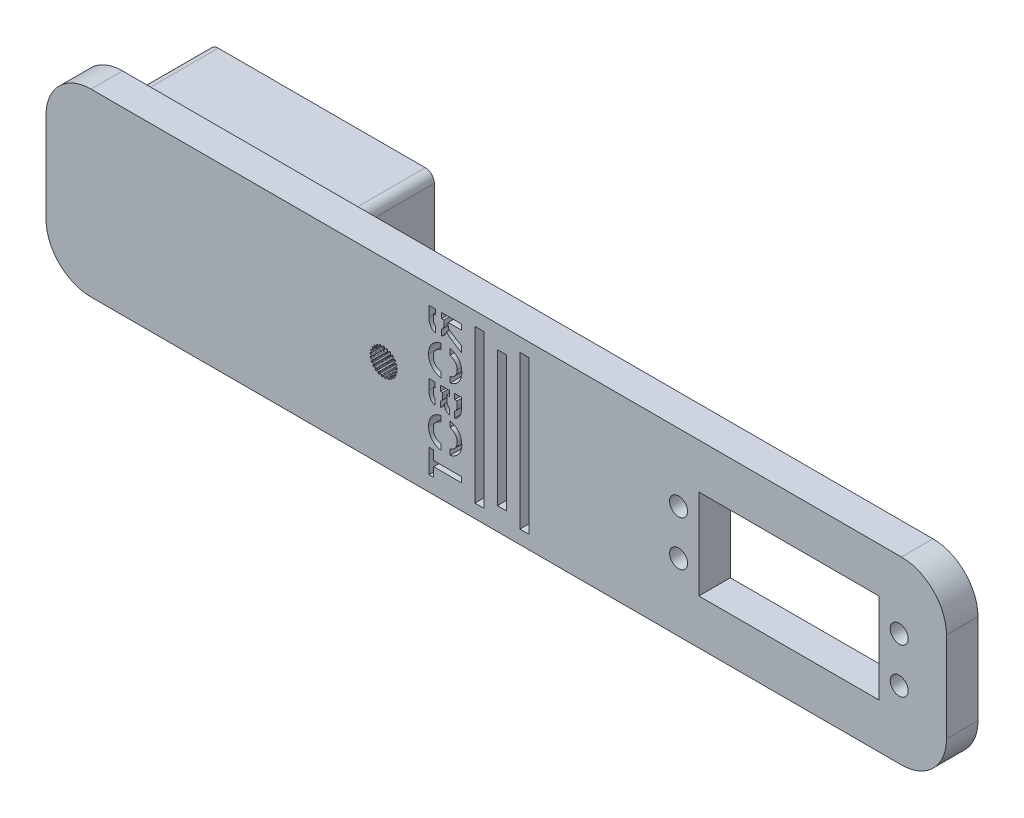
from build123d import *

# Parameters (mm, degrees)
CROQUIS1_W              = 200
CROQUIS1_H              = 40
SALIENTE_EXTRUIR1_DEPTH = 7
CROQUIS2_W              = 40
CROQUIS2_H              = 20
CORTAR_EXTRUIR1_DEPTH   = 10
CROQUIS3_R              = 2
CORTAR_EXTRUIR2_DEPTH   = 10
REDONDEO1_R             = 10
CROQUIS5_R              = 4
CORTAR_EXTRUIR3_DEPTH   = 4
CROQUIS6_W              = 50
CROQUIS6_H              = 30
SALIENTE_EXTRUIR3_DEPTH = 20
CROQUIS7_R              = 1.5
CORTAR_EXTRUIR6_DEPTH   = 10
REDONDEO3_R             = 2
CORTAR_EXTRUIR8_DEPTH   = 10
CROQUIS9_W              = 1.365556683
CROQUIS9_H              = 1.182778342
CROQUIS9_W_2            = 2
CROQUIS9_H_2            = 8
CROQUIS9_H_3            = 7
CROQUIS9_W_3            = 1.2
CROQUIS9_H_4            = 5.3
CROQUIS9_H_5            = 5
SALIENTE_EXTRUIR4_DEPTH = 7
CROQUIS10_W             = 2
CROQUIS10_H             = 34
CROQUIS10_H_2           = 30
CORTAR_EXTRUIR9_DEPTH   = 7
CROQUIS12_R             = 3.5
CROQUIS12_R_2           = 1.1
SALIENTE_EXTRUIR6_DEPTH = 3
CROQUIS13_R             = 2.75
CORTAR_EXTRUIR10_DEPTH  = 2.3


with BuildPart() as part:
    # Croquis1 → Saliente-Extruir1 (new body)
    with BuildSketch(Plane.XY):
        with Locations((35.75, 0)):
            Rectangle(CROQUIS1_W, CROQUIS1_H)
        with BuildLine():
            Line((12.626451574, 2.246768253), (12.528569084, 2.182348387))
            ThreePointArc((12.528569084, 2.182348387), (12.34583696, 2.19648114), (12.275928582, 2.365902456))
            Line((12.275928582, 2.365902456), (12.306948162, 2.47890107))
            add(Edge.make_bspline(
                [(12.306948162, 2.47890107), (12.313956369, 2.504430674), (12.318320471, 2.530953923), (12.317315161, 2.571661589), (12.315717027, 2.585623842), (12.30707454, 2.61274149), (12.299647057, 2.627040418), (12.286059536, 2.634961309)],
                knots=[0, 0, 0, 0, 0.5, 0.5, 0.75, 0.75, 1, 1, 1, 1], degree=3))
            ThreePointArc((12.286059536, 2.634961309), (12.219348706, 2.672735374), (12.151709558, 2.708820835))
            add(Edge.make_bspline(
                [(12.151709558, 2.708820835), (12.13775279, 2.71604292), (12.121806118, 2.714681589), (12.094149563, 2.707429812), (12.081587369, 2.701329447), (12.046673806, 2.680382622), (12.026552357, 2.662434562), (12.008750854, 2.642836427)],
                knots=[0, 0, 0, 0, 0.25, 0.25, 0.5, 0.5, 1, 1, 1, 1], degree=3))
            Line((12.008750854, 2.642836427), (11.929964091, 2.556098044))
            ThreePointArc((11.929964091, 2.556098044), (11.749458161, 2.524343159), (11.639612715, 2.671056287))
            Line((11.639612715, 2.671056287), (11.641556145, 2.788219097))
            add(Edge.make_bspline(
                [(11.641556145, 2.788219097), (11.641995222, 2.814689512), (11.639626154, 2.841464792), (11.628528843, 2.880643542), (11.623508646, 2.893769705), (11.608393794, 2.917886104), (11.59764366, 2.929888665), (11.58251317, 2.934181627)],
                knots=[0, 0, 0, 0, 0.5, 0.5, 0.75, 0.75, 1, 1, 1, 1], degree=3))
            ThreePointArc((11.58251317, 2.934181627), (11.508504156, 2.954178641), (11.434015927, 2.972309239))
            add(Edge.make_bspline(
                [(11.434015927, 2.972309239), (11.418701577, 2.975833522), (11.403594448, 2.970549183), (11.378610218, 2.956647329), (11.367959787, 2.947614528), (11.339352362, 2.918643136), (11.324326566, 2.896254945), (11.311958188, 2.872845469)],
                knots=[0, 0, 0, 0, 0.25, 0.25, 0.5, 0.5, 1, 1, 1, 1], degree=3))
            Line((11.311958188, 2.872845469), (11.257217615, 2.769238661))
            ThreePointArc((11.257217615, 2.769238661), (11.090279729, 2.693591414), (10.947399209, 2.808377827))
            Line((10.947399209, 2.808377827), (10.920144377, 2.922343064))
            add(Edge.make_bspline(
                [(10.920144377, 2.922343064), (10.913986734, 2.948091056), (10.905033354, 2.973435979), (10.884541326, 3.008624067), (10.876414505, 3.020089375), (10.855777008, 3.039689202), (10.842379694, 3.048641231), (10.826656941, 3.049036522)],
                knots=[0, 0, 0, 0, 0.5, 0.5, 0.75, 0.75, 1, 1, 1, 1], degree=3))
            ThreePointArc((10.826656941, 3.049036522), (10.75, 3.05), (10.673343059, 3.049036522))
            add(Edge.make_bspline(
                [(10.673343059, 3.049036522), (10.657633385, 3.048641559), (10.644315035, 3.039766248), (10.623572982, 3.020087821), (10.61550352, 3.008690147), (10.594999742, 2.973514567), (10.586013725, 2.948092979), (10.579855623, 2.922343064)],
                knots=[0, 0, 0, 0, 0.25, 0.25, 0.5, 0.5, 1, 1, 1, 1], degree=3))
            Line((10.579855623, 2.922343064), (10.552600791, 2.808377827))
            ThreePointArc((10.552600791, 2.808377827), (10.409720271, 2.693591414), (10.242782385, 2.769238661))
            Line((10.242782385, 2.769238661), (10.188041812, 2.872845469))
            add(Edge.make_bspline(
                [(10.188041812, 2.872845469), (10.175674357, 2.896253197), (10.160699238, 2.918575247), (10.132100083, 2.947561677), (10.121377275, 2.956645723), (10.096513865, 2.970497448), (10.081311173, 2.975836456), (10.065984073, 2.972309239)],
                knots=[0, 0, 0, 0, 0.5, 0.5, 0.75, 0.75, 1, 1, 1, 1], degree=3))
            ThreePointArc((10.065984073, 2.972309239), (9.991495844, 2.954178641), (9.91748683, 2.934181627))
            add(Edge.make_bspline(
                [(9.91748683, 2.934181627), (9.902368927, 2.929892236), (9.891676198, 2.917983619), (9.876479619, 2.893765087), (9.871498161, 2.880718699), (9.860386358, 2.841549142), (9.858004745, 2.814691489), (9.858443855, 2.788219097)],
                knots=[0, 0, 0, 0, 0.25, 0.25, 0.5, 0.5, 1, 1, 1, 1], degree=3))
            Line((9.858443855, 2.788219097), (9.860387285, 2.671056287))
            ThreePointArc((9.860387285, 2.671056287), (9.750541839, 2.524343159), (9.570035909, 2.556098044))
            Line((9.570035909, 2.556098044), (9.491249146, 2.642836427))
            add(Edge.make_bspline(
                [(9.491249146, 2.642836427), (9.473448973, 2.662433098), (9.453393056, 2.680329699), (9.418483765, 2.701293146), (9.405838722, 2.707425146), (9.378311658, 2.714658415), (9.362258829, 2.716048933), (9.348290442, 2.708820835)],
                knots=[0, 0, 0, 0, 0.5, 0.5, 0.75, 0.75, 1, 1, 1, 1], degree=3))
            ThreePointArc((9.348290442, 2.708820835), (9.280651294, 2.672735374), (9.213940464, 2.634961309))
            add(Edge.make_bspline(
                [(9.213940464, 2.634961309), (9.200364246, 2.627047007), (9.192969001, 2.612853348), (9.184272755, 2.585616451), (9.182692303, 2.571741101), (9.181670671, 2.531038735), (9.186043108, 2.504432581), (9.193051838, 2.47890107)],
                knots=[0, 0, 0, 0, 0.25, 0.25, 0.5, 0.5, 1, 1, 1, 1], degree=3))
            Line((9.193051838, 2.47890107), (9.224071418, 2.365902456))
            ThreePointArc((9.224071418, 2.365902456), (9.15416304, 2.19648114), (8.971430916, 2.182348387))
            Line((8.971430916, 2.182348387), (8.873548426, 2.246768253))
            add(Edge.make_bspline(
                [(8.873548426, 2.246768253), (8.851433984, 2.261322535), (8.827557457, 2.273669178), (8.788531508, 2.285292432), (8.774758767, 2.28808709), (8.746297675, 2.28824741), (8.730403367, 2.285602066), (8.718671378, 2.275127255)],
                knots=[0, 0, 0, 0, 0.5, 0.5, 0.75, 0.75, 1, 1, 1, 1], degree=3))
            ThreePointArc((8.718671378, 2.275127255), (8.662131327, 2.223354314), (8.606910368, 2.170176682))
            add(Edge.make_bspline(
                [(8.606910368, 2.170176682), (8.595728879, 2.159134754), (8.592095789, 2.143547892), (8.590446293, 2.115004024), (8.592366153, 2.101171551), (8.601498883, 2.061493855), (8.612350633, 2.036810963), (8.6254886, 2.013824572)],
                knots=[0, 0, 0, 0, 0.25, 0.25, 0.5, 0.5, 1, 1, 1, 1], degree=3))
            Line((8.6254886, 2.013824572), (8.683635255, 1.912090273))
            ThreePointArc((8.683635255, 1.912090273), (8.658056546, 1.730606132), (8.484579961, 1.671473755))
            Line((8.484579961, 1.671473755), (8.373752059, 1.709527367))
            add(Edge.make_bspline(
                [(8.373752059, 1.709527367), (8.34871288, 1.718124761), (8.322515994, 1.72414566), (8.28182553, 1.72569839), (8.267790482, 1.724980107), (8.240183677, 1.718057405), (8.22544659, 1.711542415), (8.216688161, 1.698479063)],
                knots=[0, 0, 0, 0, 0.5, 0.5, 0.75, 0.75, 1, 1, 1, 1], degree=3))
            ThreePointArc((8.216688161, 1.698479063), (8.174799827, 1.634271725), (8.134538476, 1.569031872))
            add(Edge.make_bspline(
                [(8.134538476, 1.569031872), (8.126454289, 1.555556123), (8.126811634, 1.539555439), (8.132312531, 1.511498115), (8.137612072, 1.498577664), (8.156325323, 1.462417734), (8.172974531, 1.441209022), (8.191416227, 1.422212069)],
                knots=[0, 0, 0, 0, 0.25, 0.25, 0.5, 0.5, 1, 1, 1, 1], degree=3))
            Line((8.191416227, 1.422212069), (8.273036389, 1.338134426))
            ThreePointArc((8.273036389, 1.338134426), (8.293394553, 1.155990777), (8.140073677, 1.055574279))
            Line((8.140073677, 1.055574279), (8.02326409, 1.064870589))
            add(Edge.make_bspline(
                [(8.02326409, 1.064870589), (7.996873478, 1.06697089), (7.970002278, 1.06628773), (7.930204032, 1.057672371), (7.91678855, 1.05348628), (7.89177067, 1.039915534), (7.879116787, 1.02994026), (7.873882245, 1.015109185)],
                knots=[0, 0, 0, 0, 0.5, 0.5, 0.75, 0.75, 1, 1, 1, 1], degree=3))
            ThreePointArc((7.873882245, 1.015109185), (7.849277625, 0.942501833), (7.82650565, 0.869299019))
            add(Edge.make_bspline(
                [(7.82650565, 0.869299019), (7.822026725, 0.85423618), (7.826352052, 0.838827055), (7.838657701, 0.813019221), (7.847003932, 0.801822632), (7.874121881, 0.771452529), (7.895522416, 0.755050617), (7.918109082, 0.741236752)],
                knots=[0, 0, 0, 0, 0.25, 0.25, 0.5, 0.5, 1, 1, 1, 1], degree=3))
            Line((7.918109082, 0.741236752), (8.018074257, 0.680098671))
            ThreePointArc((8.018074257, 0.680098671), (8.083090114, 0.508740269), (7.959558664, 0.37334919))
            Line((7.959558664, 0.37334919), (7.844106966, 0.353304075))
            add(Edge.make_bspline(
                [(7.844106966, 0.353304075), (7.81802314, 0.348775313), (7.792166043, 0.341431021), (7.755760685, 0.323188908), (7.743807714, 0.315798035), (7.722950724, 0.296431946), (7.713175135, 0.283623171), (7.711793384, 0.267956263)],
                knots=[0, 0, 0, 0, 0.5, 0.5, 0.75, 0.75, 1, 1, 1, 1], degree=3))
            ThreePointArc((7.711793384, 0.267956263), (7.706018478, 0.191511085), (7.702166726, 0.114944912))
            add(Edge.make_bspline(
                [(7.702166726, 0.114944912), (7.70157449, 0.099241437), (7.709596023, 0.085392082), (7.727933215, 0.06345534), (7.738801712, 0.054686135), (7.772620438, 0.032014124), (7.797427625, 0.021449605), (7.822740058, 0.013686803)],
                knots=[0, 0, 0, 0, 0.25, 0.25, 0.5, 0.5, 1, 1, 1, 1], degree=3))
            Line((7.822740058, 0.013686803), (7.934769066, -0.020670184))
            ThreePointArc((7.934769066, -0.020670184), (8.040357432, -0.170476261), (7.954377342, -0.332334803))
            Line((7.954377342, -0.332334803), (7.847537789, -0.380461833))
            add(Edge.make_bspline(
                [(7.847537789, -0.380461833), (7.823399691, -0.391335099), (7.800181394, -0.404879056), (7.769456406, -0.431601703), (7.759716995, -0.441732961), (7.744331416, -0.465677552), (7.738048359, -0.480515006), (7.740606219, -0.496033336)],
                knots=[0, 0, 0, 0, 0.5, 0.5, 0.75, 0.75, 1, 1, 1, 1], degree=3))
            ThreePointArc((7.740606219, -0.496033336), (7.754023885, -0.571513009), (7.769334376, -0.646631607))
            add(Edge.make_bspline(
                [(7.769334376, -0.646631607), (7.772666042, -0.661989012), (7.783879757, -0.673408389), (7.807096299, -0.690095674), (7.819804154, -0.695886493), (7.858198703, -0.709435846), (7.884853816, -0.713499165), (7.911301543, -0.714723137)],
                knots=[0, 0, 0, 0, 0.25, 0.25, 0.5, 0.5, 1, 1, 1, 1], degree=3))
            Line((7.911301543, -0.714723137), (8.028355188, -0.720140256))
            ThreePointArc((8.028355188, -0.720140256), (8.167881558, -0.83898114), (8.124855273, -1.017136977))
            Line((8.124855273, -1.017136977), (8.033340986, -1.090321925))
            add(Edge.make_bspline(
                [(8.033340986, -1.090321925), (8.012665303, -1.106856488), (7.993544696, -1.125749092), (7.970430643, -1.159273192), (7.963516754, -1.171508251), (7.954569319, -1.198526816), (7.95217358, -1.214460657), (7.958510333, -1.228855337)],
                knots=[0, 0, 0, 0, 0.5, 0.5, 0.75, 0.75, 1, 1, 1, 1], degree=3))
            ThreePointArc((7.958510333, -1.228855337), (7.99027749, -1.298626839), (8.023788209, -1.367577884))
            add(Edge.make_bspline(
                [(8.023788209, -1.367577884), (8.030834436, -1.381624256), (8.044535735, -1.389896134), (8.071172845, -1.400285439), (8.084921579, -1.402734013), (8.125479479, -1.406309352), (8.152307679, -1.403616158), (8.178228891, -1.398224395)],
                knots=[0, 0, 0, 0, 0.25, 0.25, 0.5, 0.5, 1, 1, 1, 1], degree=3))
            Line((8.178228891, -1.398224395), (8.292952264, -1.374361266))
            ThreePointArc((8.292952264, -1.374361266), (8.457649682, -1.454769748), (8.460280702, -1.638028695))
            Line((8.460280702, -1.638028695), (8.389841861, -1.73167308))
            add(Edge.make_bspline(
                [(8.389841861, -1.73167308), (8.373927722, -1.752830013), (8.360106223, -1.775884173), (8.346055445, -1.814103283), (8.342401504, -1.827673369), (8.340454413, -1.856068233), (8.342096526, -1.872097279), (8.351814009, -1.884463837)],
                knots=[0, 0, 0, 0, 0.5, 0.5, 0.75, 0.75, 1, 1, 1, 1], degree=3))
            ThreePointArc((8.351814009, -1.884463837), (8.39993461, -1.944143169), (8.449539955, -2.002594213))
            add(Edge.make_bspline(
                [(8.449539955, -2.002594213), (8.459858002, -2.014446966), (8.475185983, -2.019051594), (8.503569954, -2.02249012), (8.517495681, -2.021442596), (8.557668531, -2.01481927), (8.582984104, -2.005538785), (8.606750077, -1.993870071)],
                knots=[0, 0, 0, 0, 0.25, 0.25, 0.5, 0.5, 1, 1, 1, 1], degree=3))
            Line((8.606750077, -1.993870071), (8.711934685, -1.942226104))
            ThreePointArc((8.711934685, -1.942226104), (8.891454607, -1.979149823), (8.939577615, -2.155997045))
            Line((8.939577615, -2.155997045), (8.894640152, -2.264216847))
            add(Edge.make_bspline(
                [(8.894640152, -2.264216847), (8.8844875, -2.288666782), (8.876833565, -2.314433919), (8.872728924, -2.354946593), (8.872564522, -2.368999047), (8.877740118, -2.396986056), (8.883316902, -2.412103143), (8.895804531, -2.421664544)],
                knots=[0, 0, 0, 0, 0.5, 0.5, 0.75, 0.75, 1, 1, 1, 1], degree=3))
            ThreePointArc((8.895804531, -2.421664544), (8.957254981, -2.467501833), (9.019838066, -2.511780182))
            add(Edge.make_bspline(
                [(9.019838066, -2.511780182), (9.032779613, -2.520694566), (9.048771162, -2.521342617), (9.077118525, -2.517614308), (9.090346241, -2.513136507), (9.127609833, -2.496730684), (9.149822107, -2.481446035), (9.169939537, -2.464233558)],
                knots=[0, 0, 0, 0, 0.25, 0.25, 0.5, 0.5, 1, 1, 1, 1], degree=3))
            Line((9.169939537, -2.464233558), (9.258976245, -2.388053733))
            ThreePointArc((9.258976245, -2.388053733), (9.442038775, -2.379172636), (9.532630026, -2.538496172))
            Line((9.532630026, -2.538496172), (9.516017526, -2.654491542))
            add(Edge.make_bspline(
                [(9.516017526, -2.654491542), (9.512264289, -2.680698199), (9.511258844, -2.707559271), (9.51735825, -2.747819947), (9.520693716, -2.761471803), (9.532666797, -2.78729243), (9.541827843, -2.800547697), (9.556300973, -2.806703161)],
                knots=[0, 0, 0, 0, 0.5, 0.5, 0.75, 0.75, 1, 1, 1, 1], degree=3))
            ThreePointArc((9.556300973, -2.806703161), (9.627220114, -2.835818282), (9.698848615, -2.863141765))
            add(Edge.make_bspline(
                [(9.698848615, -2.863141765), (9.713600496, -2.868557655), (9.729250805, -2.86520841), (9.755780391, -2.854547531), (9.76747895, -2.846920809), (9.799491875, -2.821763326), (9.817205173, -2.801434904), (9.832410008, -2.779760188)],
                knots=[0, 0, 0, 0, 0.25, 0.25, 0.5, 0.5, 1, 1, 1, 1], degree=3))
            Line((9.832410008, -2.779760188), (9.899704311, -2.683831163))
            ThreePointArc((9.899704311, -2.683831163), (10.074806956, -2.629703282), (10.202174268, -2.761492248))
            Line((10.202174268, -2.761492248), (10.214930556, -2.877974772))
            add(Edge.make_bspline(
                [(10.214930556, -2.877974772), (10.217812565, -2.90429149), (10.223518785, -2.930558716), (10.239438989, -2.968037668), (10.246064745, -2.98043113), (10.264082998, -3.00246297), (10.276252684, -3.013023538), (10.291801916, -3.015386296)],
                knots=[0, 0, 0, 0, 0.5, 0.5, 0.75, 0.75, 1, 1, 1, 1], degree=3))
            ThreePointArc((10.291801916, -3.015386296), (10.367733638, -3.025949839), (10.443906871, -3.034601621))
            add(Edge.make_bspline(
                [(10.443906871, -3.034601621), (10.459542172, -3.036178717), (10.473867874, -3.029042621), (10.496912731, -3.012119033), (10.50634707, -3.001822605), (10.531097839, -2.9694942), (10.543199168, -2.945399316), (10.552536032, -2.920624261)],
                knots=[0, 0, 0, 0, 0.25, 0.25, 0.5, 0.5, 1, 1, 1, 1], degree=3))
            Line((10.552536032, -2.920624261), (10.593859583, -2.810973611))
            ThreePointArc((10.593859583, -2.810973611), (10.75, -2.715), (10.906140417, -2.810973611))
            Line((10.906140417, -2.810973611), (10.947463968, -2.920624261))
            add(Edge.make_bspline(
                [(10.947463968, -2.920624261), (10.956800135, -2.945397466), (10.968859477, -2.969420379), (10.993600155, -3.001762667), (11.003099879, -3.012119007), (11.026031152, -3.028977719), (11.040444811, -3.03618003), (11.056093129, -3.034601621)],
                knots=[0, 0, 0, 0, 0.5, 0.5, 0.75, 0.75, 1, 1, 1, 1], degree=3))
            ThreePointArc((11.056093129, -3.034601621), (11.132266362, -3.025949839), (11.208198084, -3.015386296))
            add(Edge.make_bspline(
                [(11.208198084, -3.015386296), (11.223734381, -3.013025504), (11.23583534, -3.002550944), (11.253947476, -2.980428019), (11.2605248, -2.968108848), (11.27645823, -2.930640833), (11.28218722, -2.904293456), (11.285069444, -2.877974772)],
                knots=[0, 0, 0, 0, 0.25, 0.25, 0.5, 0.5, 1, 1, 1, 1], degree=3))
            Line((11.285069444, -2.877974772), (11.297825732, -2.761492248))
            ThreePointArc((11.297825732, -2.761492248), (11.425193044, -2.629703282), (11.600295689, -2.683831163))
            Line((11.600295689, -2.683831163), (11.667589992, -2.779760188))
            add(Edge.make_bspline(
                [(11.667589992, -2.779760188), (11.682793692, -2.801433286), (11.700448423, -2.821702439), (11.732455027, -2.846875878), (11.744231816, -2.854544369), (11.770635253, -2.865170658), (11.786387222, -2.868562164), (11.801151385, -2.863141765)],
                knots=[0, 0, 0, 0, 0.5, 0.5, 0.75, 0.75, 1, 1, 1, 1], degree=3))
            ThreePointArc((11.801151385, -2.863141765), (11.872779886, -2.835818282), (11.943699027, -2.806703161))
            add(Edge.make_bspline(
                [(11.943699027, -2.806703161), (11.958160117, -2.800552817), (11.967275985, -2.787397949), (11.979317347, -2.761465751), (11.982624379, -2.747897895), (11.988739315, -2.707644524), (11.987735991, -2.680700157), (11.983982474, -2.654491542)],
                knots=[0, 0, 0, 0, 0.25, 0.25, 0.5, 0.5, 1, 1, 1, 1], degree=3))
            Line((11.983982474, -2.654491542), (11.967369974, -2.538496172))
            ThreePointArc((11.967369974, -2.538496172), (12.057961225, -2.379172636), (12.241023755, -2.388053733))
            Line((12.241023755, -2.388053733), (12.330060463, -2.464233558))
            add(Edge.make_bspline(
                [(12.330060463, -2.464233558), (12.35017639, -2.48144475), (12.372317199, -2.496686557), (12.409578637, -2.513109407), (12.422892513, -2.51760821), (12.451109087, -2.521334387), (12.467209612, -2.520701987), (12.480161934, -2.511780182)],
                knots=[0, 0, 0, 0, 0.5, 0.5, 0.75, 0.75, 1, 1, 1, 1], degree=3))
            ThreePointArc((12.480161934, -2.511780182), (12.542745019, -2.467501833), (12.604195469, -2.421664544))
            add(Edge.make_bspline(
                [(12.604195469, -2.421664544), (12.61667271, -2.412111097), (12.622230703, -2.39710249), (12.627444688, -2.368990435), (12.627273635, -2.355026412), (12.623185853, -2.314516952), (12.615513259, -2.288668608), (12.605359848, -2.264216847)],
                knots=[0, 0, 0, 0, 0.25, 0.25, 0.5, 0.5, 1, 1, 1, 1], degree=3))
            Line((12.605359848, -2.264216847), (12.560422385, -2.155997045))
            ThreePointArc((12.560422385, -2.155997045), (12.608545393, -1.979149823), (12.788065315, -1.942226104))
            Line((12.788065315, -1.942226104), (12.893249923, -1.993870071))
            add(Edge.make_bspline(
                [(12.893249923, -1.993870071), (12.917014121, -2.005537914), (12.942249819, -2.014794677), (12.982424817, -2.02143503), (12.99643922, -2.022481469), (13.024695981, -2.019073404), (13.040133407, -2.014456834), (13.050460045, -2.002594213)],
                knots=[0, 0, 0, 0, 0.5, 0.5, 0.75, 0.75, 1, 1, 1, 1], degree=3))
            ThreePointArc((13.050460045, -2.002594213), (13.10006539, -1.944143169), (13.148185991, -1.884463837))
            add(Edge.make_bspline(
                [(13.148185991, -1.884463837), (13.15789539, -1.872107566), (13.15954628, -1.856188265), (13.157605275, -1.827662736), (13.153966885, -1.814179958), (13.139933234, -1.775959767), (13.126073467, -1.752831593), (13.110158139, -1.73167308)],
                knots=[0, 0, 0, 0, 0.25, 0.25, 0.5, 0.5, 1, 1, 1, 1], degree=3))
            Line((13.110158139, -1.73167308), (13.039719298, -1.638028695))
            ThreePointArc((13.039719298, -1.638028695), (13.042350318, -1.454769748), (13.207047736, -1.374361266))
            Line((13.207047736, -1.374361266), (13.321771109, -1.398224395))
            add(Edge.make_bspline(
                [(13.321771109, -1.398224395), (13.347690385, -1.403615755), (13.374435321, -1.406305837), (13.414999536, -1.402746455), (13.428833889, -1.400274778), (13.455355361, -1.389946614), (13.469159698, -1.38163595), (13.476211791, -1.367577884)],
                knots=[0, 0, 0, 0, 0.5, 0.5, 0.75, 0.75, 1, 1, 1, 1], degree=3))
            ThreePointArc((13.476211791, -1.367577884), (13.50972251, -1.298626839), (13.541489667, -1.228855337))
            add(Edge.make_bspline(
                [(13.541489667, -1.228855337), (13.547821148, -1.214472631), (13.545461203, -1.198642904), (13.536487167, -1.171496266), (13.529610054, -1.159341906), (13.506512321, -1.125812499), (13.487336241, -1.106857723), (13.466659014, -1.090321925)],
                knots=[0, 0, 0, 0, 0.25, 0.25, 0.5, 0.5, 1, 1, 1, 1], degree=3))
            Line((13.466659014, -1.090321925), (13.375144727, -1.017136977))
            ThreePointArc((13.375144727, -1.017136977), (13.332118442, -0.83898114), (13.471644812, -0.720140256))
            Line((13.471644812, -0.720140256), (13.588698457, -0.714723137))
            add(Edge.make_bspline(
                [(13.588698457, -0.714723137), (13.615144209, -0.713499256), (13.641717899, -0.709453629), (13.680122533, -0.695918162), (13.692907573, -0.690083673), (13.716027314, -0.673484365), (13.727331184, -0.662001797), (13.730665624, -0.646631607)],
                knots=[0, 0, 0, 0, 0.5, 0.5, 0.75, 0.75, 1, 1, 1, 1], degree=3))
            ThreePointArc((13.730665624, -0.646631607), (13.745976115, -0.571513009), (13.759393781, -0.496033336))
            add(Edge.make_bspline(
                [(13.759393781, -0.496033336), (13.761949514, -0.480527915), (13.755727018, -0.465782402), (13.740283823, -0.441720378), (13.7306001, -0.431658137), (13.699889601, -0.404926291), (13.676602111, -0.391335911), (13.652462211, -0.380461833)],
                knots=[0, 0, 0, 0, 0.25, 0.25, 0.5, 0.5, 1, 1, 1, 1], degree=3))
            Line((13.652462211, -0.380461833), (13.545622658, -0.332334803))
            ThreePointArc((13.545622658, -0.332334803), (13.459642568, -0.170476261), (13.565230934, -0.020670184))
            Line((13.565230934, -0.020670184), (13.677259942, 0.013686803))
            add(Edge.make_bspline(
                [(13.677259942, 0.013686803), (13.702570484, 0.021449025), (13.727303207, 0.031976159), (13.761135154, 0.054637229), (13.772067551, 0.063467926), (13.790332863, 0.085295383), (13.798426003, 0.099228363), (13.797833274, 0.114944912)],
                knots=[0, 0, 0, 0, 0.5, 0.5, 0.75, 0.75, 1, 1, 1, 1], degree=3))
            ThreePointArc((13.797833274, 0.114944912), (13.793981522, 0.191511085), (13.788206616, 0.267956263))
            add(Edge.make_bspline(
                [(13.788206616, 0.267956263), (13.786826014, 0.283610138), (13.777131949, 0.296344921), (13.756189949, 0.315810427), (13.74430808, 0.3231483), (13.707914469, 0.341402925), (13.681978808, 0.348774975), (13.655893034, 0.353304075)],
                knots=[0, 0, 0, 0, 0.25, 0.25, 0.5, 0.5, 1, 1, 1, 1], degree=3))
            Line((13.655893034, 0.353304075), (13.540441336, 0.37334919))
            ThreePointArc((13.540441336, 0.37334919), (13.416909886, 0.508740269), (13.481925743, 0.680098671))
            Line((13.481925743, 0.680098671), (13.581890918, 0.741236752))
            add(Edge.make_bspline(
                [(13.581890918, 0.741236752), (13.604475898, 0.755049585), (13.625813604, 0.771396768), (13.65294708, 0.801759561), (13.66133991, 0.813031603), (13.673603116, 0.838715708), (13.677977004, 0.85422364), (13.67349435, 0.869299019)],
                knots=[0, 0, 0, 0, 0.5, 0.5, 0.75, 0.75, 1, 1, 1, 1], degree=3))
            ThreePointArc((13.67349435, 0.869299019), (13.650722375, 0.942501833), (13.626117755, 1.015109185))
            add(Edge.make_bspline(
                [(13.626117755, 1.015109185), (13.620887567, 1.029927923), (13.608331048, 1.039851804), (13.583206104, 1.053497701), (13.569872672, 1.05765014), (13.530082691, 1.06628054), (13.503128493, 1.066971047), (13.47673591, 1.064870589)],
                knots=[0, 0, 0, 0, 0.25, 0.25, 0.5, 0.5, 1, 1, 1, 1], degree=3))
            Line((13.47673591, 1.064870589), (13.359926323, 1.055574279))
            ThreePointArc((13.359926323, 1.055574279), (13.206605447, 1.155990777), (13.226963611, 1.338134426))
            Line((13.226963611, 1.338134426), (13.308583773, 1.422212069))
            add(Edge.make_bspline(
                [(13.308583773, 1.422212069), (13.327024092, 1.441207603), (13.343626056, 1.462347681), (13.362356165, 1.498504392), (13.367682076, 1.511509514), (13.373172633, 1.539436441), (13.373552441, 1.555544904), (13.365461524, 1.569031872)],
                knots=[0, 0, 0, 0, 0.5, 0.5, 0.75, 0.75, 1, 1, 1, 1], degree=3))
            ThreePointArc((13.365461524, 1.569031872), (13.325200173, 1.634271725), (13.283311839, 1.698479063))
            add(Edge.make_bspline(
                [(13.283311839, 1.698479063), (13.274560696, 1.711531548), (13.259930694, 1.718020973), (13.2322015, 1.72498984), (13.218254292, 1.725695933), (13.177568094, 1.724159827), (13.15128899, 1.718125403), (13.126247941, 1.709527367)],
                knots=[0, 0, 0, 0, 0.25, 0.25, 0.5, 0.5, 1, 1, 1, 1], degree=3))
            Line((13.126247941, 1.709527367), (13.015420039, 1.671473755))
            ThreePointArc((13.015420039, 1.671473755), (12.841943454, 1.730606132), (12.816364745, 1.912090273))
            Line((12.816364745, 1.912090273), (12.8745114, 2.013824572))
            add(Edge.make_bspline(
                [(12.8745114, 2.013824572), (12.887648385, 2.036809246), (12.898471445, 2.06141391), (12.907621304, 2.101092681), (12.909545649, 2.115013723), (12.907918567, 2.14342872), (12.90428043, 2.159125561), (12.893089632, 2.170176682)],
                knots=[0, 0, 0, 0, 0.5, 0.5, 0.75, 0.75, 1, 1, 1, 1], degree=3))
            ThreePointArc((12.893089632, 2.170176682), (12.837868673, 2.223354314), (12.781328622, 2.275127255))
            add(Edge.make_bspline(
                [(12.781328622, 2.275127255), (12.769606392, 2.285593352), (12.753822164, 2.288240566), (12.725231047, 2.288094523), (12.711546418, 2.285309903), (12.672520466, 2.273703811), (12.648567668, 2.261323622), (12.626451574, 2.246768253)],
                knots=[0, 0, 0, 0, 0.25, 0.25, 0.5, 0.5, 1, 1, 1, 1], degree=3))
        make_face(mode=Mode.SUBTRACT)
    extrude(amount=SALIENTE_EXTRUIR1_DEPTH)

    # Croquis2 → Cortar-Extruir1 (cut)
    with BuildSketch(Plane.XY.offset(7)):
        with Locations((100.75, 0)):
            Rectangle(CROQUIS2_W, CROQUIS2_H)
    extrude(amount=-CORTAR_EXTRUIR1_DEPTH, mode=Mode.SUBTRACT)

    # Croquis3 → Cortar-Extruir2 (cut)
    with BuildSketch(Plane.XY.offset(7)):
        with Locations((125.25, -5)):
            Circle(CROQUIS3_R)
        with Locations((125.25, 5)):
            Circle(CROQUIS3_R)
        with Locations((76.25, -5)):
            Circle(CROQUIS3_R)
        with Locations((76.25, 5)):
            Circle(CROQUIS3_R)
    extrude(amount=-CORTAR_EXTRUIR2_DEPTH, mode=Mode.SUBTRACT)

    # Redondeo1
    redondeo1_edges = [part.edges().sort_by_distance(p)[0] for p in [
        (-64.25, 20, 3.5),
        (135.75, 20, 3.5),
        (135.75, -20, 3.5),
        (-64.25, -20, 3.5),
    ]]
    fillet(redondeo1_edges, radius=REDONDEO1_R)

    # Croquis5 → Cortar-Extruir3 (cut)
    with BuildSketch(Plane(origin=(0, 0, 0), x_dir=(-1, 0, 0), z_dir=(0, 0, -1))):
        with Locations((-76.25, 5)):
            Circle(CROQUIS5_R)
        with Locations((-76.25, -5)):
            Circle(CROQUIS5_R)
        with Locations((-125.25, -5)):
            Circle(CROQUIS5_R)
        with Locations((-125.25, 5)):
            Circle(CROQUIS5_R)
    extrude(amount=-CORTAR_EXTRUIR3_DEPTH, mode=Mode.SUBTRACT)

    # Croquis6 → Saliente-Extruir3 (add)
    with BuildSketch(Plane(origin=(0, 0, 0), x_dir=(-1, 0, 0), z_dir=(0, 0, -1))):
        with Locations((30, 0)):
            Rectangle(CROQUIS6_W, CROQUIS6_H)
        Polygon((8, 9), (11, 9), (11, 12), (52, 12), (52, -9), (49, -9), (49, -12), (8, -12), align=None, mode=Mode.SUBTRACT)
    extrude(amount=SALIENTE_EXTRUIR3_DEPTH)

    # Croquis7 → Cortar-Extruir6 (cut)
    with BuildSketch(Plane(origin=(0, 0, -20), x_dir=(-1, 0, 0), z_dir=(0, 0, -1))):
        with Locations((8, 12)):
            Circle(CROQUIS7_R)
        with Locations((52, -12)):
            Circle(CROQUIS7_R)
    extrude(amount=-CORTAR_EXTRUIR6_DEPTH, mode=Mode.SUBTRACT)

    # Redondeo3
    redondeo3_edges = [part.edges().sort_by_distance(p)[0] for p in [
        (-11, 9, -10),
        (-49, -9, -10),
        (-5, 15, -10),
        (-55, 15, -10),
        (-55, -15, -10),
        (-5, -15, -10),
    ]]
    fillet(redondeo3_edges, radius=REDONDEO3_R)

    # Croquis8 → Cortar-Extruir8 (cut)
    # profile 1 of 5: a face of its own
    with BuildSketch(Plane(origin=(0, 0, 0), x_dir=(-1, 0, 0), z_dir=(0, 0, -1))):
        with BuildLine():
            Line((-28.00618762, 10.430626501), (-28.00618762, 11.817434107))
            Line((-28.00618762, 11.817434107), (-26.070866559, 12.960293679))
            add(Edge.make_bspline(
                [(-26.070866559, 12.960293679), (-25.987369997, 13.010443049), (-25.831169227, 13.104259728), (-25.620105585, 13.253749568), (-25.445481747, 13.402492715), (-25.303716928, 13.555324394), (-25.195141965, 13.71706574), (-25.122990345, 13.89524463), (-25.078909072, 14.090130751), (-25.074953918, 14.227094067), (-25.072897333, 14.298311679)],
                knots=[0, 0, 0, 0, 1.323310799, 2.475576959, 3.510754942, 4.43521603, 5.30084183, 6.141627031, 7.033691003, 8, 8, 8, 8], degree=3))
            Line((-25.072897333, 14.298311679), (-25.072897333, 14.777336907))
            Line((-25.072897333, 14.777336907), (-28.00618762, 14.777336907))
            Line((-28.00618762, 14.777336907), (-28.00618762, 15.960115249))
            Line((-28.00618762, 15.960115249), (-20.814895303, 15.960115249))
            Line((-20.814895303, 15.960115249), (-20.814895303, 13.604907876))
            add(Edge.make_bspline(
                [(-20.814895303, 13.604907876), (-20.816288085, 13.522559102), (-20.819020522, 13.361002834), (-20.841319481, 13.12327123), (-20.879766974, 12.895550323), (-20.932728275, 12.678004756), (-20.999984033, 12.472383659), (-21.083761883, 12.280201163), (-21.180563807, 12.100487955), (-21.294749805, 11.93595133), (-21.424113981, 11.787226594), (-21.568054917, 11.654056561), (-21.729414054, 11.540516873), (-21.903863603, 11.441633472), (-22.094883706, 11.365007553), (-22.2999693, 11.308168066), (-22.521030471, 11.276005756), (-22.673233737, 11.271330668), (-22.751694837, 11.268920651)],
                knots=[0, 0, 0, 0, 1.153521462, 2.263040625, 3.341337503, 4.38624968, 5.397122795, 6.368068286, 7.319674246, 8.252383051, 9.167524369, 10.076419807, 10.992185972, 11.925661073, 12.879543516, 13.867788059, 14.900840317, 16, 16, 16, 16], degree=3))
            add(Edge.make_bspline(
                [(-22.751694837, 11.268920651), (-22.813844246, 11.270429392), (-22.936027731, 11.273395523), (-23.115676436, 11.294149853), (-23.287265706, 11.329631645), (-23.451006901, 11.378653404), (-23.605946978, 11.440397692), (-23.752086206, 11.51524141), (-23.889802051, 11.600961452), (-24.019141592, 11.698286326), (-24.136731202, 11.809313483), (-24.24932595, 11.926845146), (-24.349086915, 12.058635507), (-24.442811465, 12.198559937), (-24.525782508, 12.349319592), (-24.595541803, 12.510598996), (-24.66100471, 12.67838397), (-24.692993729, 12.795841511), (-24.709192993, 12.855322102)],
                knots=[0, 0, 0, 0, 1.09156399, 2.145975237, 3.171383398, 4.165512793, 5.144450992, 6.096811633, 7.045585514, 7.990877933, 8.934226244, 9.883473879, 10.846164453, 11.832917356, 12.840188317, 13.86325536, 14.917950834, 16, 16, 16, 16], degree=3))
            Line((-24.709192993, 12.855322102), (-24.729891614, 12.855322102))
            add(Edge.make_bspline(
                [(-24.729891614, 12.855322102), (-24.767345594, 12.793681218), (-24.839771976, 12.674483576), (-24.970218385, 12.516639905), (-25.107671431, 12.376105587), (-25.246789368, 12.239366961), (-25.399408986, 12.10792663), (-25.571387525, 11.979231118), (-25.767610335, 11.844798435), (-25.906621636, 11.752671947), (-25.98067971, 11.703591691)],
                knots=[0, 0, 0, 0, 1.007333154, 1.947923689, 2.854426628, 3.755965988, 4.674540902, 5.668205659, 6.757739869, 8, 8, 8, 8], degree=3))
            Line((-25.98067971, 11.703591691), (-28.00618762, 10.430626501))
        make_face()
        with BuildLine():
            Line((-21.761117976, 14.777336907), (-24.126674659, 14.777336907))
            Line((-24.126674659, 14.777336907), (-24.126674659, 13.788238519))
            add(Edge.make_bspline(
                [(-24.126674659, 13.788238519), (-24.125483428, 13.743339776), (-24.123145368, 13.655215853), (-24.106336788, 13.525632084), (-24.07996117, 13.401424699), (-24.04326662, 13.282241849), (-23.994506192, 13.170538502), (-23.935945959, 13.065985667), (-23.869972189, 12.968352373), (-23.794091097, 12.878627285), (-23.707798118, 12.798803401), (-23.612621642, 12.727554987), (-23.508876083, 12.664995468), (-23.396085555, 12.613687587), (-23.275551559, 12.571498638), (-23.147513782, 12.542911073), (-23.012453696, 12.524235402), (-22.92030659, 12.522222265), (-22.872929617, 12.52118722)],
                knots=[0, 0, 0, 0, 1.074370724, 2.108695173, 3.12195728, 4.110548581, 5.08781706, 6.032954475, 6.975143395, 7.90394827, 8.838650852, 9.782241456, 10.745096954, 11.731998114, 12.742854643, 13.795775028, 14.866708795, 16, 16, 16, 16], degree=3))
            add(Edge.make_bspline(
                [(-22.872929617, 12.52118722), (-22.830475537, 12.521689642), (-22.747693137, 12.522669329), (-22.627201449, 12.54047498), (-22.51346314, 12.564285278), (-22.406960749, 12.600467552), (-22.308107723, 12.646462018), (-22.214813041, 12.70097142), (-22.13097946, 12.768373954), (-22.053201999, 12.844201154), (-21.983653672, 12.929673386), (-21.924441864, 13.025437664), (-21.874018082, 13.129512072), (-21.832671611, 13.242486624), (-21.800377841, 13.364255602), (-21.776544536, 13.494701947), (-21.763589893, 13.634211476), (-21.761957658, 13.730059795), (-21.761117976, 13.779367681)],
                knots=[0, 0, 0, 0, 1.066624438, 2.079840893, 3.057245445, 3.986214421, 4.901269529, 5.796207348, 6.696366002, 7.599166298, 8.524489645, 9.459968529, 10.4245567, 11.428480888, 12.480821637, 13.589470439, 14.759935305, 16, 16, 16, 16], degree=3))
            Line((-21.761117976, 13.779367681), (-21.761117976, 14.777336907))
        make_face(mode=Mode.SUBTRACT)
    # profile 2 of 5: a face of its own
    with BuildSketch(Plane(origin=(0, 0, 0), x_dir=(-1, 0, 0), z_dir=(0, 0, -1))):
        with BuildLine():
            add(Edge.make_bspline(
                [(-28.100809888, 6.670869847), (-28.097555158, 6.796673766), (-28.091189279, 7.042731812), (-28.04525804, 7.402388097), (-27.966936452, 7.742666023), (-27.857159204, 8.063813911), (-27.7169701, 8.366218468), (-27.54142122, 8.646806218), (-27.338478129, 8.910873037), (-27.103048223, 9.151887562), (-26.844116917, 9.369875071), (-26.564561696, 9.560805502), (-26.265233785, 9.720582333), (-25.947896215, 9.85362649), (-25.61015279, 9.952370244), (-25.255567244, 10.02766492), (-24.881237786, 10.07015263), (-24.625515691, 10.075842046), (-24.494814418, 10.078749944)],
                knots=[0, 0, 0, 0, 1.080772804, 2.11386774, 3.109173853, 4.075987392, 5.025038086, 5.966272846, 6.914037973, 7.881268696, 8.854993546, 9.81805361, 10.784245676, 11.765646471, 12.769053207, 13.802980878, 14.877088833, 16, 16, 16, 16], degree=3))
            add(Edge.make_bspline(
                [(-24.494814418, 10.078749944), (-24.354726264, 10.076071654), (-24.081209048, 10.070842387), (-23.681709358, 10.025381779), (-23.30401923, 9.952710277), (-22.948148124, 9.848627835), (-22.613319293, 9.715691277), (-22.300883025, 9.551204584), (-22.010030576, 9.357473434), (-21.742951871, 9.13599504), (-21.50132796, 8.889724313), (-21.291773804, 8.619091241), (-21.114752049, 8.32674025), (-20.968694838, 8.01379994), (-20.859086188, 7.678194665), (-20.776543732, 7.323277894), (-20.729652976, 6.94613565), (-20.723447888, 6.687751829), (-20.720273035, 6.555548959)],
                knots=[0, 0, 0, 0, 1.15222704, 2.249682958, 3.303300419, 4.313064797, 5.295631801, 6.262317599, 7.212562825, 8.165710149, 9.111907019, 10.045395757, 10.97510803, 11.91840756, 12.880046247, 13.874430042, 14.912445645, 16, 16, 16, 16], degree=3))
            add(Edge.make_bspline(
                [(-20.720273035, 6.555548959), (-20.723528173, 6.432701597), (-20.729891972, 6.192534816), (-20.77582861, 5.841178201), (-20.854606742, 5.509124281), (-20.96215341, 5.194174891), (-21.103914666, 4.898542749), (-21.275876396, 4.620500874), (-21.480408035, 4.361785328), (-21.713476316, 4.12317409), (-21.971108675, 3.908173626), (-22.249916859, 3.720255098), (-22.548058312, 3.561270481), (-22.866435211, 3.433698209), (-23.202131759, 3.329552378), (-23.558168827, 3.260859671), (-23.932854649, 3.216434809), (-24.189129817, 3.211045717), (-24.320354613, 3.208286252)],
                knots=[0, 0, 0, 0, 1.065692615, 2.083430705, 3.067636031, 4.022280856, 4.965132829, 5.906034102, 6.852939541, 7.820500082, 8.79496093, 9.759085981, 10.732692833, 11.720421136, 12.730767492, 13.777262481, 14.861855098, 16, 16, 16, 16], degree=3))
            add(Edge.make_bspline(
                [(-24.320354613, 3.208286252), (-24.462406135, 3.210977693), (-24.739349685, 3.216224924), (-25.143378829, 3.261309422), (-25.5245201, 3.335171106), (-25.884260026, 3.435786198), (-26.21950403, 3.569995046), (-26.533140798, 3.731204314), (-26.822091113, 3.925040856), (-27.088580224, 4.144515872), (-27.326681696, 4.390320626), (-27.534824594, 4.657258486), (-27.710455317, 4.944422483), (-27.853155762, 5.251632335), (-27.963911473, 5.578427587), (-28.043866825, 5.925008973), (-28.091553261, 6.291543642), (-28.097679564, 6.542592699), (-28.100809888, 6.670869847)],
                knots=[0, 0, 0, 0, 1.177162618, 2.29499542, 3.364500604, 4.39244573, 5.386145376, 6.352647156, 7.309989713, 8.264504434, 9.209143387, 10.140645842, 11.064711375, 11.993091647, 12.942558309, 13.919569025, 14.93697369, 16, 16, 16, 16], degree=3))
        make_face()
        with BuildLine():
            add(Edge.make_bspline(
                [(-21.761117976, 6.616166349), (-21.763452835, 6.696119707), (-21.768043375, 6.853315138), (-21.802359015, 7.083495718), (-21.860227582, 7.302060803), (-21.940458323, 7.508908842), (-22.042920629, 7.704356021), (-22.170204638, 7.887422673), (-22.320107732, 8.059287608), (-22.491760196, 8.217854195), (-22.679944392, 8.36365859), (-22.887111577, 8.48693218), (-23.106397632, 8.594030886), (-23.340229999, 8.682356051), (-23.589808215, 8.747421286), (-23.852997318, 8.796867267), (-24.131017161, 8.824474929), (-24.320789983, 8.828737039), (-24.417933826, 8.830918794)],
                knots=[0, 0, 0, 0, 0.988277837, 1.943042342, 2.86970776, 3.778308816, 4.680451489, 5.591439712, 6.528602368, 7.494308428, 8.476557367, 9.466130372, 10.46895181, 11.49087912, 12.550597948, 13.653642968, 14.798910525, 16, 16, 16, 16], degree=3))
            add(Edge.make_bspline(
                [(-24.417933826, 8.830918794), (-24.51459752, 8.829407879), (-24.703427269, 8.82645635), (-24.979744013, 8.797791255), (-25.24164622, 8.750654685), (-25.489754372, 8.686107908), (-25.723092423, 8.601868686), (-25.941371942, 8.497391389), (-26.146653006, 8.37642571), (-26.335099646, 8.23625874), (-26.505154432, 8.081373005), (-26.654390498, 7.914037438), (-26.778938275, 7.733759546), (-26.882464709, 7.542742339), (-26.962428255, 7.339691241), (-27.018116715, 7.125176087), (-27.053351252, 6.899714375), (-27.057725631, 6.745420164), (-27.059964947, 6.666434429)],
                knots=[0, 0, 0, 0, 1.209576796, 2.362873517, 3.472383614, 4.537664675, 5.56795712, 6.572273746, 7.56245417, 8.545712799, 9.506284641, 10.437062317, 11.345664602, 12.242634409, 13.150985398, 14.06964528, 15.011819787, 16, 16, 16, 16], degree=3))
            add(Edge.make_bspline(
                [(-27.059964947, 6.666434429), (-27.058152308, 6.583041565), (-27.054598282, 6.419533846), (-27.021646235, 6.181164859), (-26.966996645, 5.956776008), (-26.891242562, 5.745783813), (-26.793041924, 5.548653148), (-26.674665639, 5.363759389), (-26.532439256, 5.194134155), (-26.369688899, 5.039071643), (-26.187851366, 4.900085495), (-25.987823136, 4.779642728), (-25.770715451, 4.677578572), (-25.536199156, 4.593110045), (-25.284155735, 4.528459434), (-25.015055344, 4.483524174), (-24.729541423, 4.454540398), (-24.533328259, 4.451673522), (-24.432718555, 4.450203511)],
                knots=[0, 0, 0, 0, 1.028373538, 2.01632373, 2.961538043, 3.873148788, 4.775856215, 5.673039178, 6.575255091, 7.499810268, 8.441007585, 9.39298277, 10.374777683, 11.395991303, 12.463621828, 13.58009586, 14.759176832, 16, 16, 16, 16], degree=3))
            add(Edge.make_bspline(
                [(-24.432718555, 4.450203511), (-24.329172316, 4.451856341), (-24.127634158, 4.455073341), (-23.834523503, 4.481386364), (-23.559337939, 4.527375733), (-23.302666022, 4.590281855), (-23.063310359, 4.670266676), (-22.842189994, 4.768622024), (-22.640508807, 4.888220484), (-22.455990751, 5.02204852), (-22.293270216, 5.173853335), (-22.149572522, 5.338419711), (-22.029330021, 5.518527298), (-21.931459829, 5.712412353), (-21.85391083, 5.919001475), (-21.799683856, 6.139287208), (-21.766285696, 6.373160693), (-21.762870653, 6.533748861), (-21.761117976, 6.616166349)],
                knots=[0, 0, 0, 0, 1.275971675, 2.483499004, 3.622776443, 4.711370894, 5.736996491, 6.729241299, 7.687558615, 8.621725317, 9.532842858, 10.424170042, 11.308537927, 12.194031307, 13.095400077, 14.021954072, 14.984821984, 16, 16, 16, 16], degree=3))
        make_face(mode=Mode.SUBTRACT)
    # profile 3 of 5: a face of its own
    with BuildSketch(Plane(origin=(0, 0, 0), x_dir=(-1, 0, 0), z_dir=(0, 0, -1))):
        with BuildLine():
            Line((-28.00618762, 1.861397415), (-20.814895303, 1.861397415))
            Line((-20.814895303, 1.861397415), (-20.814895303, -0.409537001))
            add(Edge.make_bspline(
                [(-20.814895303, -0.409537001), (-20.816436916, -0.493841982), (-20.819443822, -0.658278278), (-20.839228354, -0.89809249), (-20.877052438, -1.124127902), (-20.92662169, -1.33675579), (-20.989929692, -1.537133532), (-21.069943303, -1.722886908), (-21.163141028, -1.896199955), (-21.271212219, -2.053376665), (-21.388564596, -2.196478808), (-21.518400512, -2.318888778), (-21.654123616, -2.425882419), (-21.801147454, -2.510158721), (-21.95555887, -2.577889399), (-22.119312924, -2.624138817), (-22.291154516, -2.65590453), (-22.40903077, -2.658464011), (-22.469306508, -2.659772796)],
                knots=[0, 0, 0, 0, 1.29321255, 2.522402362, 3.686871397, 4.805358411, 5.86919678, 6.905471082, 7.903342584, 8.882513086, 9.827167866, 10.736122769, 11.614610136, 12.471629195, 13.32824809, 14.19425496, 15.076636638, 16, 16, 16, 16], degree=3))
            add(Edge.make_bspline(
                [(-22.469306508, -2.659772796), (-22.51961863, -2.658558776), (-22.619025878, -2.656160101), (-22.765808299, -2.639435976), (-22.907666597, -2.613010772), (-23.044554146, -2.576545983), (-23.175556151, -2.526513717), (-23.302423085, -2.467940258), (-23.424635156, -2.398402695), (-23.539299822, -2.316302938), (-23.64908568, -2.22702437), (-23.749378354, -2.127007669), (-23.843354252, -2.020269741), (-23.928785397, -1.905002429), (-24.006476113, -1.781701004), (-24.073619024, -1.649478582), (-24.135571115, -1.510344879), (-24.167904909, -1.412746155), (-24.184335104, -1.363152039)],
                knots=[0, 0, 0, 0, 1.044047944, 2.062841511, 3.061830658, 4.036920506, 4.998180123, 5.968268512, 6.934954113, 7.911116195, 8.891982185, 9.868358572, 10.846875434, 11.841035983, 12.842796257, 13.86747693, 14.916373149, 16, 16, 16, 16], degree=3))
            Line((-24.184335104, -1.363152039), (-24.203555252, -1.363152039))
            add(Edge.make_bspline(
                [(-24.203555252, -1.363152039), (-24.211291605, -1.423477791), (-24.226438495, -1.541588669), (-24.267964421, -1.71214596), (-24.317579788, -1.874109916), (-24.379570678, -2.027444173), (-24.455318485, -2.170442242), (-24.541439157, -2.30484806), (-24.639602599, -2.429467666), (-24.748576553, -2.544740674), (-24.868416498, -2.648298773), (-24.997053207, -2.738710535), (-25.1347913, -2.815165663), (-25.281291464, -2.876546647), (-25.436361871, -2.926527703), (-25.600605025, -2.959254487), (-25.773125649, -2.980784771), (-25.890917607, -2.983598832), (-25.951110251, -2.98503684)],
                knots=[0, 0, 0, 0, 1.105197932, 2.163850295, 3.187126427, 4.184003295, 5.166148081, 6.125708003, 7.083089199, 8.046658442, 9.006092802, 9.958342805, 10.901056294, 11.864833898, 12.842675954, 13.85858675, 14.905720485, 16, 16, 16, 16], degree=3))
            add(Edge.make_bspline(
                [(-25.951110251, -2.98503684), (-26.026156472, -2.982774947), (-26.173100764, -2.978346048), (-26.387815962, -2.943251565), (-26.59133832, -2.887427995), (-26.78429321, -2.808530441), (-26.965452197, -2.705332255), (-27.136379278, -2.580664696), (-27.295740396, -2.432486396), (-27.442458033, -2.263130323), (-27.574051291, -2.076289945), (-27.690836953, -1.876903391), (-27.787767447, -1.665090971), (-27.868456686, -1.441703867), (-27.929935972, -1.206542082), (-27.974303454, -0.959416036), (-28.001272545, -0.70090468), (-28.004530529, -0.524430268), (-28.00618762, -0.434671041)],
                knots=[0, 0, 0, 0, 0.982317545, 1.923427403, 2.8409632, 3.741014849, 4.645567072, 5.564644947, 6.505422824, 7.48894802, 8.493506847, 9.494139937, 10.510569398, 11.539441117, 12.600772783, 13.68943852, 14.824791592, 16, 16, 16, 16], degree=3))
            Line((-28.00618762, -0.434671041), (-28.00618762, 1.861397415))
        make_face()
        with BuildLine():
            Line((-21.761117976, 0.678619074), (-23.842807857, 0.678619074))
            Line((-23.842807857, 0.678619074), (-23.842807857, -0.090186849))
            add(Edge.make_bspline(
                [(-23.842807857, -0.090186849), (-23.842220241, -0.140511361), (-23.841076823, -0.238435811), (-23.824582779, -0.380905039), (-23.804666681, -0.516055414), (-23.769118419, -0.641496176), (-23.728544332, -0.759902809), (-23.676504659, -0.869183282), (-23.615839017, -0.970396098), (-23.545936377, -1.062605236), (-23.468001441, -1.145323279), (-23.381575345, -1.217634595), (-23.285529084, -1.276135932), (-23.183724897, -1.327296501), (-23.073370152, -1.365726451), (-22.955722113, -1.391795135), (-22.830530088, -1.408539109), (-22.74435822, -1.410784467), (-22.699948285, -1.411941645)],
                knots=[0, 0, 0, 0, 1.217730545, 2.369533015, 3.470124009, 4.520938767, 5.521137799, 6.497999481, 7.445557499, 8.373986296, 9.294095119, 10.192512585, 11.093146414, 12.011085897, 12.947076371, 13.913974302, 14.924936085, 16, 16, 16, 16], degree=3))
            add(Edge.make_bspline(
                [(-22.699948285, -1.411941645), (-22.661939777, -1.411296972), (-22.588076897, -1.410044163), (-22.4812471, -1.394423137), (-22.381254828, -1.371627111), (-22.289260872, -1.337002469), (-22.203771975, -1.29437154), (-22.126756393, -1.240412685), (-22.056187577, -1.177904699), (-21.994122115, -1.104856347), (-21.939543355, -1.022530104), (-21.889780809, -0.932220067), (-21.850352594, -0.830553317), (-21.81867811, -0.719467061), (-21.791114132, -0.599752384), (-21.77487104, -0.469988261), (-21.761752595, -0.33095146), (-21.761334284, -0.23462118), (-21.761117976, -0.184809116)],
                knots=[0, 0, 0, 0, 1.033773763, 2.008958317, 2.933067993, 3.820214093, 4.678174138, 5.526642016, 6.372241466, 7.238032157, 8.12730583, 9.057723496, 10.039254519, 11.087807723, 12.200967183, 13.379161911, 14.644773411, 16, 16, 16, 16], degree=3))
            Line((-21.761117976, -0.184809116), (-21.761117976, 0.678619074))
        make_face(mode=Mode.SUBTRACT)
        with BuildLine():
            Line((-24.789030531, 0.678619074), (-27.059964947, 0.678619074))
            Line((-27.059964947, 0.678619074), (-27.059964947, -0.334134882))
            add(Edge.make_bspline(
                [(-27.059964947, -0.334134882), (-27.059307209, -0.387894864), (-27.058025253, -0.492675103), (-27.042519677, -0.644738492), (-27.019745153, -0.787827393), (-26.985145124, -0.92109262), (-26.94329936, -1.045952117), (-26.889062693, -1.160286195), (-26.827667326, -1.266315652), (-26.754486407, -1.360599531), (-26.67443216, -1.446090158), (-26.585752199, -1.519625318), (-26.489697383, -1.582905334), (-26.386400035, -1.634317004), (-26.275866905, -1.674723681), (-26.158278607, -1.702653826), (-26.033371922, -1.718843863), (-25.947708431, -1.721208762), (-25.903799118, -1.72242096)],
                knots=[0, 0, 0, 0, 1.259711535, 2.455225457, 3.579574161, 4.65272412, 5.679347729, 6.661319729, 7.614322676, 8.54550905, 9.452591405, 10.354879228, 11.239239016, 12.143373899, 13.053394181, 13.992074989, 14.97077964, 16, 16, 16, 16], degree=3))
            add(Edge.make_bspline(
                [(-25.903799118, -1.72242096), (-25.858908768, -1.721273023), (-25.771224888, -1.719030768), (-25.643979739, -1.702004314), (-25.526053742, -1.66967391), (-25.415510201, -1.62931418), (-25.314602574, -1.574245212), (-25.223194056, -1.506426589), (-25.140041927, -1.427325728), (-25.064043536, -1.337260332), (-24.999127255, -1.233798888), (-24.942331196, -1.118966948), (-24.896155158, -0.991142266), (-24.855338478, -0.852208037), (-24.827188983, -0.700478103), (-24.804641024, -0.537737279), (-24.791416263, -0.362935178), (-24.789842291, -0.242491373), (-24.789030531, -0.180373697)],
                knots=[0, 0, 0, 0, 0.994668398, 1.942876034, 2.835505072, 3.699487564, 4.544844098, 5.37259676, 6.214561113, 7.08281157, 7.97644195, 8.914090081, 9.916104153, 10.984077127, 12.119114242, 13.331417407, 14.623705467, 16, 16, 16, 16], degree=3))
            Line((-24.789030531, -0.180373697), (-24.789030531, 0.678619074))
        make_face(mode=Mode.SUBTRACT)
    # profile 4 of 5: a face of its own
    with BuildSketch(Plane(origin=(0, 0, 0), x_dir=(-1, 0, 0), z_dir=(0, 0, -1))):
        with BuildLine():
            add(Edge.make_bspline(
                [(-28.100809888, -7.238603451), (-28.097555158, -7.112799533), (-28.091189279, -6.866741487), (-28.04525804, -6.507085202), (-27.966936452, -6.166807275), (-27.857159204, -5.845659387), (-27.7169701, -5.543254831), (-27.54142122, -5.262667081), (-27.338478129, -4.998600262), (-27.103048223, -4.757585737), (-26.844116917, -4.539598228), (-26.564561696, -4.348667797), (-26.265233785, -4.188890966), (-25.947896215, -4.055846809), (-25.61015279, -3.957103055), (-25.255567244, -3.881808379), (-24.881237786, -3.839320668), (-24.625515691, -3.833631253), (-24.494814418, -3.830723354)],
                knots=[0, 0, 0, 0, 1.080772804, 2.11386774, 3.109173853, 4.075987392, 5.025038086, 5.966272846, 6.914037973, 7.881268696, 8.854993546, 9.81805361, 10.784245676, 11.765646471, 12.769053207, 13.802980878, 14.877088833, 16, 16, 16, 16], degree=3))
            add(Edge.make_bspline(
                [(-24.494814418, -3.830723354), (-24.354726264, -3.833401644), (-24.081209048, -3.838630912), (-23.681709358, -3.88409152), (-23.30401923, -3.956763021), (-22.948148124, -4.060845463), (-22.613319293, -4.193782022), (-22.300883025, -4.358268715), (-22.010030576, -4.551999864), (-21.742951871, -4.773478259), (-21.50132796, -5.019748986), (-21.291773804, -5.290382057), (-21.114752049, -5.582733049), (-20.968694838, -5.895673358), (-20.859086188, -6.231278634), (-20.776543732, -6.586195404), (-20.729652976, -6.963337648), (-20.723447888, -7.221721469), (-20.720273035, -7.35392434)],
                knots=[0, 0, 0, 0, 1.15222704, 2.249682958, 3.303300419, 4.313064797, 5.295631801, 6.262317599, 7.212562825, 8.165710149, 9.111907019, 10.045395757, 10.97510803, 11.91840756, 12.880046247, 13.874430042, 14.912445645, 16, 16, 16, 16], degree=3))
            add(Edge.make_bspline(
                [(-20.720273035, -7.35392434), (-20.723528173, -7.476771701), (-20.729891972, -7.716938483), (-20.77582861, -8.068295098), (-20.854606742, -8.400349018), (-20.96215341, -8.715298407), (-21.103914666, -9.01093055), (-21.275876396, -9.288972425), (-21.480408035, -9.547687971), (-21.713476316, -9.786299208), (-21.971108675, -10.001299672), (-22.249916859, -10.189218201), (-22.548058312, -10.348202818), (-22.866435211, -10.47577509), (-23.202131759, -10.579920921), (-23.558168827, -10.648613628), (-23.932854649, -10.69303849), (-24.189129817, -10.698427581), (-24.320354613, -10.701187047)],
                knots=[0, 0, 0, 0, 1.065692615, 2.083430705, 3.067636031, 4.022280856, 4.965132829, 5.906034102, 6.852939541, 7.820500082, 8.79496093, 9.759085981, 10.732692833, 11.720421136, 12.730767492, 13.777262481, 14.861855098, 16, 16, 16, 16], degree=3))
            add(Edge.make_bspline(
                [(-24.320354613, -10.701187047), (-24.462406135, -10.698495606), (-24.739349685, -10.693248375), (-25.143378829, -10.648163877), (-25.5245201, -10.574302193), (-25.884260026, -10.473687101), (-26.21950403, -10.339478253), (-26.533140798, -10.178268984), (-26.822091113, -9.984432443), (-27.088580224, -9.764957426), (-27.326681696, -9.519152673), (-27.534824594, -9.252214813), (-27.710455317, -8.965050816), (-27.853155762, -8.657840964), (-27.963911473, -8.331045712), (-28.043866825, -7.984464326), (-28.091553261, -7.617929657), (-28.097679564, -7.3668806), (-28.100809888, -7.238603451)],
                knots=[0, 0, 0, 0, 1.177162618, 2.29499542, 3.364500604, 4.39244573, 5.386145376, 6.352647156, 7.309989713, 8.264504434, 9.209143387, 10.140645842, 11.064711375, 11.993091647, 12.942558309, 13.919569025, 14.93697369, 16, 16, 16, 16], degree=3))
        make_face()
        with BuildLine():
            add(Edge.make_bspline(
                [(-21.761117976, -7.29330695), (-21.763452835, -7.213353592), (-21.768043375, -7.056158161), (-21.802359015, -6.82597758), (-21.860227582, -6.607412496), (-21.940458323, -6.400564457), (-22.042920629, -6.205117278), (-22.170204638, -6.022050626), (-22.320107732, -5.850185691), (-22.491760196, -5.691619104), (-22.679944392, -5.545814709), (-22.887111577, -5.422541119), (-23.106397632, -5.315442412), (-23.340229999, -5.227117248), (-23.589808215, -5.162052013), (-23.852997318, -5.112606032), (-24.131017161, -5.08499837), (-24.320789983, -5.08073626), (-24.417933826, -5.078554505)],
                knots=[0, 0, 0, 0, 0.988277837, 1.943042342, 2.86970776, 3.778308816, 4.680451489, 5.591439712, 6.528602368, 7.494308428, 8.476557367, 9.466130372, 10.46895181, 11.49087912, 12.550597948, 13.653642968, 14.798910525, 16, 16, 16, 16], degree=3))
            add(Edge.make_bspline(
                [(-24.417933826, -5.078554505), (-24.51459752, -5.08006542), (-24.703427269, -5.083016949), (-24.979744013, -5.111682043), (-25.24164622, -5.158818614), (-25.489754372, -5.223365391), (-25.723092423, -5.307604613), (-25.941371942, -5.412081909), (-26.146653006, -5.533047589), (-26.335099646, -5.673214559), (-26.505154432, -5.828100294), (-26.654390498, -5.995435861), (-26.778938275, -6.175713753), (-26.882464709, -6.36673096), (-26.962428255, -6.569782057), (-27.018116715, -6.784297212), (-27.053351252, -7.009758924), (-27.057725631, -7.164053135), (-27.059964947, -7.24303887)],
                knots=[0, 0, 0, 0, 1.209576796, 2.362873517, 3.472383614, 4.537664675, 5.56795712, 6.572273746, 7.56245417, 8.545712799, 9.506284641, 10.437062317, 11.345664602, 12.242634409, 13.150985398, 14.06964528, 15.011819787, 16, 16, 16, 16], degree=3))
            add(Edge.make_bspline(
                [(-27.059964947, -7.24303887), (-27.058152308, -7.326431734), (-27.054598282, -7.489939452), (-27.021646235, -7.72830844), (-26.966996645, -7.952697291), (-26.891242562, -8.163689486), (-26.793041924, -8.360820151), (-26.674665639, -8.54571391), (-26.532439256, -8.715339144), (-26.369688899, -8.870401656), (-26.187851366, -9.009387803), (-25.987823136, -9.129830571), (-25.770715451, -9.231894727), (-25.536199156, -9.316363253), (-25.284155735, -9.381013865), (-25.015055344, -9.425949125), (-24.729541423, -9.454932901), (-24.533328259, -9.457799777), (-24.432718555, -9.459269788)],
                knots=[0, 0, 0, 0, 1.028373538, 2.01632373, 2.961538043, 3.873148788, 4.775856215, 5.673039178, 6.575255091, 7.499810268, 8.441007585, 9.39298277, 10.374777683, 11.395991303, 12.463621828, 13.58009586, 14.759176832, 16, 16, 16, 16], degree=3))
            add(Edge.make_bspline(
                [(-24.432718555, -9.459269788), (-24.329172316, -9.457616958), (-24.127634158, -9.454399957), (-23.834523503, -9.428086935), (-23.559337939, -9.382097566), (-23.302666022, -9.319191443), (-23.063310359, -9.239206623), (-22.842189994, -9.140851275), (-22.640508807, -9.021252814), (-22.455990751, -8.887424779), (-22.293270216, -8.735619964), (-22.149572522, -8.571053588), (-22.029330021, -8.390946), (-21.931459829, -8.197060946), (-21.85391083, -7.990471824), (-21.799683856, -7.770186091), (-21.766285696, -7.536312606), (-21.762870653, -7.375724438), (-21.761117976, -7.29330695)],
                knots=[0, 0, 0, 0, 1.275971675, 2.483499004, 3.622776443, 4.711370894, 5.736996491, 6.729241299, 7.687558615, 8.621725317, 9.532842858, 10.424170042, 11.308537927, 12.194031307, 13.095400077, 14.021954072, 14.984821984, 16, 16, 16, 16], degree=3))
        make_face(mode=Mode.SUBTRACT)
    # profile 5 of 5: a face of its own
    with BuildSketch(Plane(origin=(0, 0, 0), x_dir=(-1, 0, 0), z_dir=(0, 0, -1))):
        Polygon((-21.855740243, -16.638734322), (-21.855740243, -14.583656954), (-28.00618762, -14.583656954), (-28.00618762, -13.396443193), (-21.855740243, -13.396443193), (-21.855740243, -11.345801243), (-20.814895303, -11.345801243), (-20.814895303, -16.638734322), align=None)
    extrude(amount=-CORTAR_EXTRUIR8_DEPTH, mode=Mode.SUBTRACT)


with BuildPart() as cortar_extruir8_piece_1:
    # of the separate pieces the step leaves, piece 1, a body of its own (cortar_extruir8_pieces)
    add(part.part.solids().sort_by_distance((125.75, 20, 0))[0])



with BuildPart() as cortar_extruir8_piece_2:
    # of the separate pieces the step leaves, piece 2, a body of its own (cortar_extruir8_pieces)
    add(part.part.solids().sort_by_distance((21.761117976, -7.29330695, 0))[0])


with BuildPart() as cortar_extruir8_piece_3:
    # of the separate pieces the step leaves, piece 3, a body of its own (cortar_extruir8_pieces)
    add(part.part.solids().sort_by_distance((21.761117976, 6.616166349, 0))[0])


with BuildPart() as cortar_extruir8_piece_4:
    # of the separate pieces the step leaves, piece 4, a body of its own (cortar_extruir8_pieces)
    add(part.part.solids().sort_by_distance((24.789030531, 0.678619074, 0))[0])


with BuildPart() as cortar_extruir8_piece_5:
    # of the separate pieces the step leaves, piece 5, a body of its own (cortar_extruir8_pieces)
    add(part.part.solids().sort_by_distance((21.761117976, 14.777336907, 0))[0])


with BuildPart() as cortar_extruir8_piece_6:
    # of the separate pieces the step leaves, piece 6, a body of its own (cortar_extruir8_pieces)
    add(part.part.solids().sort_by_distance((21.761117976, 0.678619074, 0))[0])


with BuildPart() as cortar_extruir8_piece_1_1:
    add(cortar_extruir8_piece_1.part)

    add(cortar_extruir8_piece_2.part)  # Saliente-Extruir4 merges Cortar-Extruir8 piece 2

    add(cortar_extruir8_piece_3.part)  # Saliente-Extruir4 merges Cortar-Extruir8 piece 3

    add(cortar_extruir8_piece_4.part)  # Saliente-Extruir4 merges Cortar-Extruir8 piece 4

    add(cortar_extruir8_piece_5.part)  # Saliente-Extruir4 merges Cortar-Extruir8 piece 5

    add(cortar_extruir8_piece_6.part)  # Saliente-Extruir4 merges Cortar-Extruir8 piece 6
    # Croquis9 → Saliente-Extruir4 (add)
    with BuildSketch(Plane(origin=(0, 0, 0), x_dir=(-1, 0, 0), z_dir=(0, 0, -1))):
        with Locations((-22.943896318, 15.368726078)):
            Rectangle(CROQUIS9_W, CROQUIS9_H)
        with BuildLine():
            Line((-23.626674659, 12.739588033), (-23.626674659, 11.452828365))
            add(Edge.make_bspline(
                [(-22.751694837, 11.268920651), (-22.813844246, 11.270429392), (-22.936027731, 11.273395523), (-23.115676436, 11.294149853), (-23.287265706, 11.329631645), (-23.451006901, 11.378653404), (-23.562482743, 11.423077008), (-23.619887271, 11.449635791), (-23.626674659, 11.452828365)],
                knots=[0, 0, 0, 0, 0.068222749, 0.134123452, 0.198211462, 0.26034455, 0.321528187, 0.329760132, 0.329760132, 0.329760132, 0.329760132], degree=3))
            add(Edge.make_bspline(
                [(-22.261117976, 11.321466089), (-22.273316184, 11.318603395), (-22.3575495, 11.299790691), (-22.521030471, 11.276005756), (-22.673233737, 11.271330668), (-22.751694837, 11.268920651)],
                knots=[0.855770901, 0.855770901, 0.855770901, 0.855770901, 0.866736754, 0.93130252, 1, 1, 1, 1], degree=3))
            Line((-22.261117976, 11.321466089), (-22.261117976, 12.674538648))
            add(Edge.make_bspline(
                [(-22.872929617, 12.52118722), (-22.830475537, 12.521689642), (-22.747693137, 12.522669329), (-22.627201449, 12.54047498), (-22.51346314, 12.564285278), (-22.406960749, 12.600467552), (-22.324129115, 12.639007564), (-22.27654431, 12.665371165), (-22.261117976, 12.674538648)],
                knots=[0, 0, 0, 0, 0.066664027, 0.129990056, 0.19107784, 0.249138401, 0.306329346, 0.334518499, 0.334518499, 0.334518499, 0.334518499], degree=3))
            add(Edge.make_bspline(
                [(-23.626674659, 12.739588033), (-23.621863228, 12.736240401), (-23.583815367, 12.71018454), (-23.508876083, 12.664995468), (-23.396085555, 12.613687587), (-23.275551559, 12.571498638), (-23.147513782, 12.542911073), (-23.012453696, 12.524235402), (-22.92030659, 12.522222265), (-22.872929617, 12.52118722)],
                knots=[0.602626597, 0.602626597, 0.602626597, 0.602626597, 0.611390091, 0.67156856, 0.733249882, 0.796428415, 0.862235939, 0.9291693, 1, 1, 1, 1], degree=3))
        make_face()
        with Locations((-24.494814418, 6.645401363)):
            Rectangle(CROQUIS9_W_2, CROQUIS9_H_2)
        with Locations((-24.494814418, -7.264071936)):
            Rectangle(CROQUIS9_W_2, CROQUIS9_H_3)
        with Locations((-25.924497739, -0.588602585)):
            Rectangle(CROQUIS9_W_3, CROQUIS9_H_4)
        with Locations((-22.801962917, -0.421380926)):
            Rectangle(CROQUIS9_W_3, CROQUIS9_H_5)
    extrude(amount=-SALIENTE_EXTRUIR4_DEPTH)

    # Croquis10 → Cortar-Extruir9 (cut)
    with BuildSketch(Plane(origin=(0, 0, 0), x_dir=(-1, 0, 0), z_dir=(0, 0, -1))):
        with Locations((-32.00618762, 0)):
            Rectangle(CROQUIS10_W, CROQUIS10_H)
        with Locations((-37.00618762, 0)):
            Rectangle(CROQUIS10_W, CROQUIS10_H_2)
        with Locations((-42.00618762, 0)):
            Rectangle(CROQUIS10_W, CROQUIS10_H)
    extrude(amount=-CORTAR_EXTRUIR9_DEPTH, mode=Mode.SUBTRACT)

    # Croquis12 → Saliente-Extruir6 (add)
    with BuildSketch(Plane(origin=(0, 0, 0), x_dir=(-1, 0, 0), z_dir=(0, 0, -1))):
        with Locations((-10.75, 0)):
            Circle(CROQUIS12_R)
        with Locations((-10.75, 0)):
            Circle(CROQUIS12_R_2, mode=Mode.SUBTRACT)
    extrude(amount=-SALIENTE_EXTRUIR6_DEPTH)

    # Croquis13 → Cortar-Extruir10 (cut)
    with BuildSketch(Plane(origin=(0, 0, 0), x_dir=(-1, 0, 0), z_dir=(0, 0, -1))):
        with Locations((-10.75, 0)):
            Circle(CROQUIS13_R)
    extrude(amount=-CORTAR_EXTRUIR10_DEPTH, mode=Mode.SUBTRACT)


solid = cortar_extruir8_piece_1_1.part
